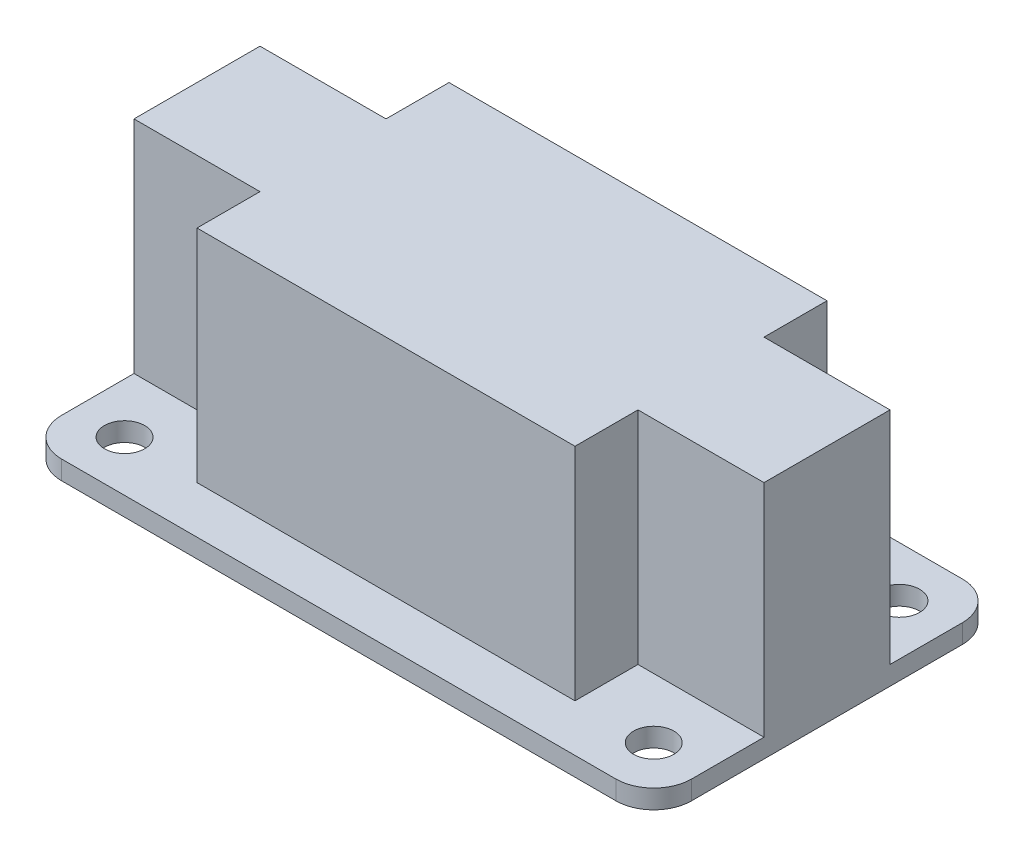
from build123d import *

# Parameters (mm, degrees)
SKETCH2_W           = 50
SKETCH2_H           = 27.5
SKETCH2_R           = 1.6
BOSS_EXTRUDE1_DEPTH = 1.5
FILLET1_R           = 3
BOSS_EXTRUDE2_DEPTH = 19


with BuildPart() as part:
    # Sketch2 → Boss-Extrude1 (new body)
    with BuildSketch(Plane(origin=(0, 0, 0), x_dir=(1, 0, 0), z_dir=(0, 1, 0))):
        with Locations((25, 13.75)):
            Rectangle(SKETCH2_W, SKETCH2_H)
        with Locations((46, 4)):
            Circle(SKETCH2_R, mode=Mode.SUBTRACT)
        with Locations((46, 23.5)):
            Circle(SKETCH2_R, mode=Mode.SUBTRACT)
        with Locations((4, 23.5)):
            Circle(SKETCH2_R, mode=Mode.SUBTRACT)
        with Locations((4, 4)):
            Circle(SKETCH2_R, mode=Mode.SUBTRACT)
    extrude(amount=BOSS_EXTRUDE1_DEPTH)

    # Fillet1
    fillet1_edges = [part.edges().sort_by_distance(p)[0] for p in [
        (0, 0.75, -27.5),
        (0, 0.75, 0),
        (50, 0.75, -27.5),
        (50, 0.75, 0),
    ]]
    fillet(fillet1_edges, radius=FILLET1_R)

    # Sketch3 → Boss-Extrude2 (add)
    with BuildSketch(Plane(origin=(0, 0, 0), x_dir=(1, 0, 0), z_dir=(0, 1, 0))):
        Polygon((0, 8.75), (10, 8.75), (10, 3.75), (40, 3.75), (40, 8.75), (50, 8.75), (50, 18.75), (40, 18.75), (40, 23.75), (10, 23.75), (10, 18.75), (0, 18.75), align=None)
    extrude(amount=BOSS_EXTRUDE2_DEPTH)


solid = part.part
